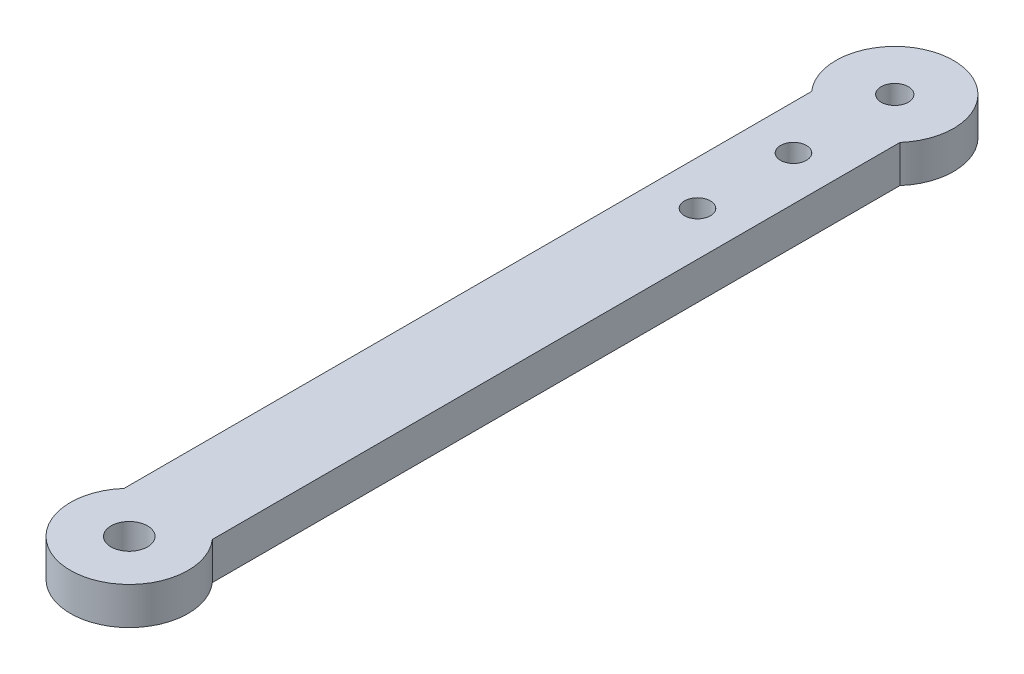
from build123d import *

# Parameters (mm, degrees)
SKETCH1_R           = 1.55
SKETCH1_R_2         = 1.1
SKETCH1_R_3         = 1.15
BOSS_EXTRUDE1_DEPTH = 3.175


with BuildPart() as part:
    # Sketch1 → Boss-Extrude1 (new body)
    with BuildSketch(Plane(origin=(0, 0, 0), x_dir=(1, 0, 0), z_dir=(0, 1, 0))):
        with BuildLine():
            Line((-3.75, -61.692810861), (-3.75, -3.307189139))
            ThreePointArc((-3.75, -3.307189139), (0, 5), (3.75, -3.307189139))
            Line((3.75, -3.307189139), (3.75, -61.692810861))
            ThreePointArc((3.75, -61.692810861), (0, -70), (-3.75, -61.692810861))
        make_face()
        with Locations((0, -65)):
            Circle(SKETCH1_R, mode=Mode.SUBTRACT)
        with Locations((0, -8.6)):
            Circle(SKETCH1_R_2, mode=Mode.SUBTRACT)
        with Locations((0, -16.75)):
            Circle(SKETCH1_R_2, mode=Mode.SUBTRACT)
        Circle(SKETCH1_R_3, mode=Mode.SUBTRACT)
    extrude(amount=BOSS_EXTRUDE1_DEPTH)


solid = part.part
